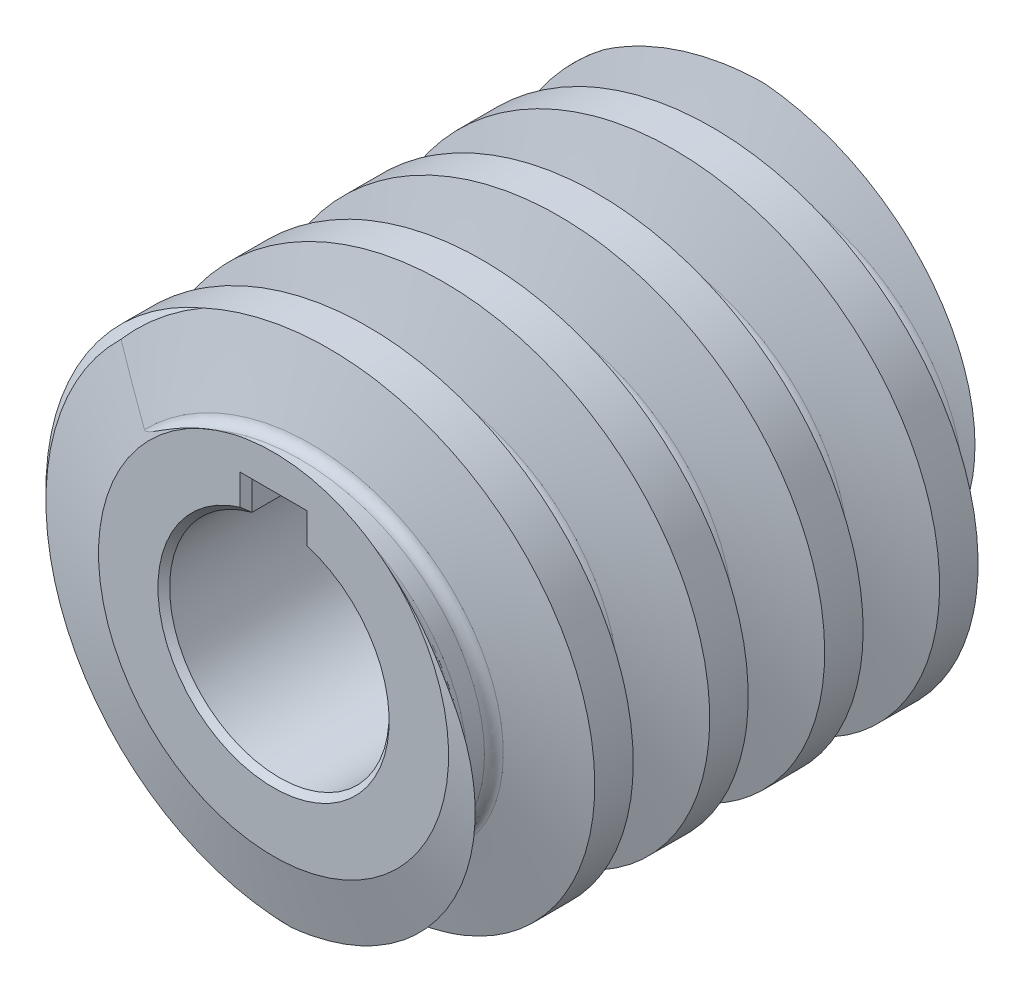
from build123d import *

# Parameters (mm, degrees)
TOOTHCUTWORM01_PITCH    = 9.974556675
BOREREVOLVESKETCH_W     = 44.45
BOREREVOLVESKETCH_H     = 9.525
KEYWAY_DEPTH            = 39.49482937
KEYWAY_DEPTH_BACK       = 39.49482937
KEYWAYSKETCH_W          = 4.7625
KEYWAYSKETCH_H          = 2.512258407
SKETCH7_OUTSIDE_W       = 80.806
SKETCH7_OUTSIDE_H       = 80.806
SKETCH7_OUTSIDE_R       = 15.1892
CUT_EXTRUDE2_DEPTH      = 2.54
CUT_EXTRUDE2_DRAFT      = -75
MIRROR1_COPY_1_SKETCH_W = 80.806
MIRROR1_COPY_1_SKETCH_H = 80.806
MIRROR1_COPY_1_SKETCH_R = 15.1892
MIRROR1_COPY_1_DEPTH    = 2.54
MIRROR1_COPY_1_DRAFT    = -75
CHAMFER1_SIZE           = 0.508


with BuildPart() as part:
    # SketchRevolveWorm01 → Worm01 (revolve)
    with BuildSketch(Plane(origin=(0, 0, 0), x_dir=(0, 0, -1), z_dir=(1, 0, 0)), mode=Mode.PRIVATE) as worm01_sk:
        Polygon((22.225, 0), (22.225, 19.75358), (19.75358, 22.225), (-19.75358, 22.225), (-22.225, 19.75358), (-22.225, 0), align=None)
    revolve(worm01_sk.sketch.rotate(Axis((0, 0, 0), (0, 0, -1)), 90), axis=Axis((0, 0, 0), (0, 0, -1)))

    # ToothCutWorm01: the profile of SketchToothWorm01 screwed along a right-hand helix of 6 turns, 16 arcs to a turn; built about Z, then put on its axis
    toothcutworm01_z = Axis((0, 0, 0), (0, 0, 1))
    toothcutworm01_corners = [(23.01875, 0, 3.523742803), (15.902404215, 0, 1.676669126), (15.1892, 0, 0.754718055), (15.1892, 0, -0.754718055), (15.902404215, 0, -1.676669126), (23.01875, 0, -3.523742803)]
    with BuildLine(mode=Mode.PRIVATE) as toothcutworm01_profile:
        Line(toothcutworm01_corners[0], toothcutworm01_corners[1])
        Line(toothcutworm01_corners[2], toothcutworm01_corners[3])
        Line(toothcutworm01_corners[4], toothcutworm01_corners[5])
        Line(toothcutworm01_corners[5], toothcutworm01_corners[0])
        ThreePointArc((15.902404215, 0, 1.676669126), (15.388312488, 0, 1.337524633), (15.1892, 0, 0.754718055))
        ThreePointArc((15.1892, 0, -0.754718055), (15.388312488, 0, -1.337524633), (15.902404215, 0, -1.676669126))
    toothcutworm01_cap = Face(toothcutworm01_profile.wire())
    toothcutworm01_arcs = [((15.902404215, 0, 1.676669126), (15.1892, 0, 1.491554354), (15.1892, 0, 0.754718055), (1, 0.7909580175607517, 1)), ((15.1892, 0, -0.754718055), (15.1892, 0, -1.491554354), (15.902404215, 0, -1.676669126), (1, 0.7909580175607547, 1))]  # start, shoulder, end, weights
    toothcutworm01_turn_angles = [0, 11.25, 22.5, 33.75, 45, 56.25, 67.5, 78.75, 90, 101.25, 112.5, 123.75, 135, 146.25, 157.5, 168.75, 180, 191.25, 202.5, 213.75, 225, 236.25, 247.5, 258.75, 270, 281.25, 292.5, 303.75, 315, 326.25, 337.5, 348.75, 360]
    toothcutworm01_turn_weights = [1, 0.9807852804032304, 1, 0.9807852804032304, 1, 0.9807852804032304, 1, 0.9807852804032304, 1, 0.9807852804032304, 1, 0.9807852804032304, 1, 0.9807852804032304, 1, 0.9807852804032304, 1, 0.9807852804032304, 1, 0.9807852804032304, 1, 0.9807852804032304, 1, 0.9807852804032304, 1, 0.9807852804032304, 1, 0.9807852804032304, 1, 0.9807852804032304, 1, 0.9807852804032304, 1]
    toothcutworm01_turn_rails = [Edge.make_bspline([Vector(p[0], p[1], 0).rotate(toothcutworm01_z, toothcutworm01_turn_angles[k]) / toothcutworm01_turn_weights[k] + Vector(0, 0, p[2] + TOOTHCUTWORM01_PITCH * toothcutworm01_turn_angles[k] / 360) for k in range(33)], [0, 0, 0, 1, 1, 2, 2, 3, 3, 4, 4, 5, 5, 6, 6, 7, 7, 8, 8, 9, 9, 10, 10, 11, 11, 12, 12, 13, 13, 14, 14, 15, 15, 16, 16, 16], 2, toothcutworm01_turn_weights) for p in toothcutworm01_corners]
    toothcutworm01_turn_sides = [*[Face.make_surface_from_curves(toothcutworm01_turn_rails[p[0]], toothcutworm01_turn_rails[p[1]]) for p in [(0, 1), (2, 3), (4, 5), (5, 0)]], *[Face.make_bezier_surface([[Vector(p[j][0], p[j][1], 0).rotate(toothcutworm01_z, toothcutworm01_turn_angles[2 * i + k]) / toothcutworm01_turn_weights[2 * i + k] + Vector(0, 0, p[j][2] + TOOTHCUTWORM01_PITCH * toothcutworm01_turn_angles[2 * i + k] / 360) for k in range(3)] for j in range(3)], [[p[3][j] * toothcutworm01_turn_weights[2 * i + k] for k in range(3)] for j in range(3)]) for p in toothcutworm01_arcs for i in range(16)]]
    toothcutworm01 = Plane(origin=(0, 0, 29.923670025), x_dir=(1, 0, 0), z_dir=(0, 0, -1)) * Solid(Shell([*[p.moved(Location((0, 0, TOOTHCUTWORM01_PITCH * i))) for i in range(6) for p in toothcutworm01_turn_sides], toothcutworm01_cap, toothcutworm01_cap.rotate(toothcutworm01_z, 2160).moved(Location((0, 0, TOOTHCUTWORM01_PITCH * 2160 / 360)))]))
    add(toothcutworm01, mode=Mode.SUBTRACT)

    # BoreRevolveSketch → BoreRevolveCut (revolve, cut)
    with BuildSketch(Plane(origin=(0, 0, 0), x_dir=(0, 0, -1), z_dir=(1, 0, 0)), mode=Mode.PRIVATE) as borerevolvecut_sk:
        with Locations((0, 4.7625)):
            Rectangle(BOREREVOLVESKETCH_W, BOREREVOLVESKETCH_H)
    revolve(borerevolvecut_sk.sketch.rotate(Axis((0, 0, 0), (0, 0, -1)), 90), axis=Axis((0, 0, 0), (0, 0, -1)), mode=Mode.SUBTRACT)

    # KeywaySketch → Keyway (cut, two sides: drawn at the far end of the back side and taken through both)
    with BuildSketch(Plane.XY.offset(-KEYWAY_DEPTH_BACK)):
        with Locations((0, 10.478670797)):
            Rectangle(KEYWAYSKETCH_W, KEYWAYSKETCH_H)
    extrude(amount=KEYWAY_DEPTH + KEYWAY_DEPTH_BACK, mode=Mode.SUBTRACT)


with BuildPart() as cut_extrude2_tool:
    # Sketch7 outside → Cut-Extrude2 (with draft: the straight prism first)
    with BuildSketch(Plane.XY.offset(22.225)):
        Rectangle(SKETCH7_OUTSIDE_W, SKETCH7_OUTSIDE_H)
        Circle(SKETCH7_OUTSIDE_R, mode=Mode.SUBTRACT)
    extrude(amount=-CUT_EXTRUDE2_DEPTH)
    # Cut-Extrude2: the draft: its side faces are tilted about the plane it starts from
    cut_extrude2_sides = [cut_extrude2_tool.faces().sort_by_distance(p)[0] for p in [
        (0, -40.403, 20.955),
        (40.403, 0, 20.955),
        (0, 40.403, 20.955),
        (-40.403, 0, 20.955),
        (-15.1892, 0, 20.955),
    ]]
    draft(cut_extrude2_sides, Plane.XY.offset(22.225), CUT_EXTRUDE2_DRAFT)


with BuildPart() as part_1:
    add(part.part)

    # Cut-Extrude2: cut by cut_extrude2_tool
    add(cut_extrude2_tool.part, mode=Mode.SUBTRACT)


with BuildPart() as mirror1_copy_1_tool:
    # Mirror1 copy 1 sketch → Mirror1 copy 1 (with draft: the straight prism first)
    with BuildSketch(Plane(origin=(0, 0, -22.225), x_dir=(1, 0, 0), z_dir=(0, 0, -1))):
        Rectangle(MIRROR1_COPY_1_SKETCH_W, MIRROR1_COPY_1_SKETCH_H)
        Circle(MIRROR1_COPY_1_SKETCH_R, mode=Mode.SUBTRACT)
    extrude(amount=-MIRROR1_COPY_1_DEPTH)
    # Mirror1 copy 1: the draft: its side faces are tilted about the plane it starts from
    mirror1_copy_1_sides = [mirror1_copy_1_tool.faces().sort_by_distance(p)[0] for p in [
        (0, -40.403, -20.955),
        (40.403, 0, -20.955),
        (0, 40.403, -20.955),
        (-40.403, 0, -20.955),
        (-15.1892, 0, -20.955),
    ]]
    draft(mirror1_copy_1_sides, Plane(origin=(0, 0, -22.225), x_dir=(1, 0, 0), z_dir=(0, 0, -1)), MIRROR1_COPY_1_DRAFT)


with BuildPart() as part_2:
    add(part_1.part)

    # Mirror1 copy 1: cut by mirror1_copy_1_tool
    add(mirror1_copy_1_tool.part, mode=Mode.SUBTRACT)

    # Chamfer1
    chamfer1_edges = [part_2.edges().sort_by_distance(p)[0] for p in [
        (0, -9.525, 22.225),
        (0, -9.525, -22.225),
        (0, 11.7348, 22.225),
        (0, 11.7348, -22.225),
        (-2.38125, 10.478670797, -22.225),
        (-2.38125, 10.478670797, 22.225),
        (2.38125, 10.478670797, -22.225),
        (2.38125, 10.478670797, 22.225),
    ]]
    chamfer(chamfer1_edges, length=CHAMFER1_SIZE)


solid = part_2.part
